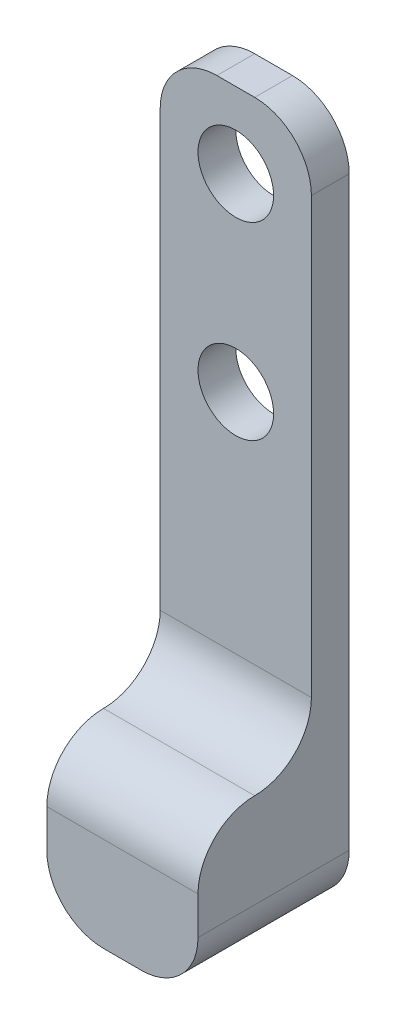
from build123d import *

# Parameters (mm, degrees)
SKETCH1_W            = 65
SKETCH1_H            = 48
BOSS_EXTRUDE1_DEPTH  = 2
M3_CLEARANCE_HOLE1_D = 4
SKETCH5_W            = 8
SKETCH5_H            = 8
BOSS_EXTRUDE2_DEPTH  = 6
CUT_EXTRUDE1_DEPTH   = 48.271281194
FILLET4_R            = 3


with BuildPart() as part:
    # Sketch1 → Boss-Extrude1 (new body)
    with BuildSketch(Plane.XY):
        with Locations((4.50867052, -4.791184971)):
            Rectangle(SKETCH1_W, SKETCH1_H)
    extrude(amount=BOSS_EXTRUDE1_DEPTH)

    # M3 Clearance Hole1 (through all)
    with Locations(Plane.XY.offset(2)):
        with Locations((4.50867052, 4.208815029), (4.50867052, -5.791184971)):
            Hole(M3_CLEARANCE_HOLE1_D / 2)

    # Sketch5 → Boss-Extrude2 (add)
    with BuildSketch(Plane.XY.offset(2)):
        with Locations((4.50867052, -24.791184971)):
            Rectangle(SKETCH5_W, SKETCH5_H)
    extrude(amount=BOSS_EXTRUDE2_DEPTH)

    # Sketch6 → Cut-Extrude1 (cut, through all)
    with BuildSketch(Plane.XY.offset(2)):
        Polygon((-27.99132948, -28.791184971), (0.50867052, -28.791184971), (0.50867052, -20.791184971), (0.50867052, 8.208815029), (8.50867052, 8.208815029), (8.50867052, -20.791184971), (8.50867052, -28.791184971), (37.00867052, -28.791184971), (37.00867052, 19.208815029), (-27.99132948, 19.208815029), align=None)
    extrude(amount=-CUT_EXTRUDE1_DEPTH, mode=Mode.SUBTRACT)

    # Fillet4
    fillet4_edges = [part.edges().sort_by_distance(p)[0] for p in [
        (8.50867052, -28.791184971, 4),
        (4.50867052, -20.791184971, 2),
        (4.50867052, -20.791184971, 8),
        (0.50867052, 8.208815029, 1),
        (8.50867052, 8.208815029, 1),
        (0.50867052, -28.791184971, 4),
    ]]
    fillet(fillet4_edges, radius=FILLET4_R - 0.0001)  # a hair under: the kernel refuses the full size


solid = part.part
